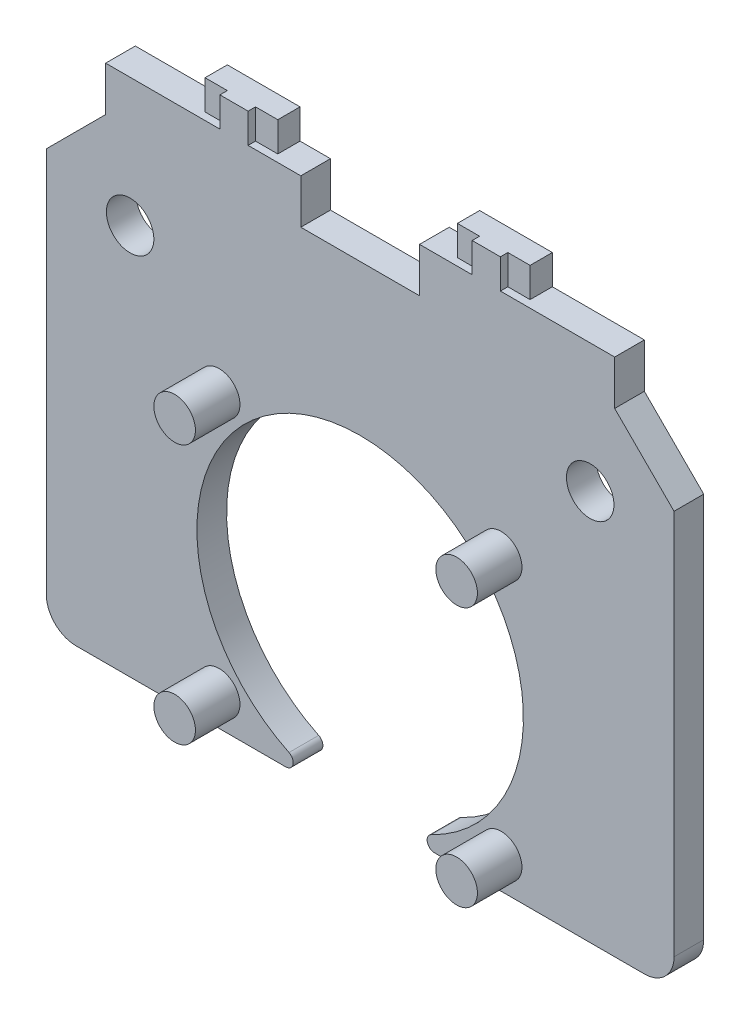
from build123d import *

# Parameters (mm, degrees)
STOCK_DRIVEBLOCK_CNC_10MM_MASTER_1_OUTLI_R = 1.6
STOCK_DRIVEBLOCK_CNC_10MM_MASTER_1_DEPTH   = 2
STOCK_DRIVEBLOCK_CNC_10MM_MASTER_1_START   = 2
STOCK_DRIVEBLOCK_CNC_10MM_MASTER_1_2_OUT_R = 1.4
STOCK_DRIVEBLOCK_CNC_10MM_MASTER_1_2_DEPTH = 3
SKETCH1_W                                  = 34.3
SKETCH1_H                                  = 2
BOSS_EXTRUDE1_DEPTH                        = 3
BOSS_EXTRUDE2_DEPTH                        = 2
SKETCH3_W                                  = 8
SKETCH3_H                                  = 3
CUT_EXTRUDE1_DEPTH                         = 10


# Read off the part's stored shape, not the designer's step: Stock-driveblock-cnc-10mm-master-1
with BuildPart() as part:
    # Stock-driveblock-cnc-10mm-master-1 outli → Stock-driveblock-cnc-10mm-master-1 (new body)
    with BuildSketch(Plane.XY):
        with BuildLine():
            Line((21.15, -8.85), (21.15, 17.15))
            Line((21.15, 17.15), (17.15, 21.15))
            Line((17.15, 21.15), (-17.15, 21.15))
            Line((-17.15, 21.15), (-21.15, 17.15))
            Line((-21.15, 17.15), (-21.15, -8.85))
            ThreePointArc((-21.15, -8.85), (-20.564213562, -10.264213562), (-19.15, -10.85))
            Line((-19.15, -10.85), (-5.012733785, -10.85))
            ThreePointArc((-5.012733785, -10.85), (-4.525394068, -10.461803399), (-4.794788838, -9.9))
            ThreePointArc((-4.794788838, -9.9), (0, 11), (4.794788838, -9.9))
            ThreePointArc((4.794788838, -9.9), (4.525394068, -10.461803399), (5.012733785, -10.85))
            Line((5.012733785, -10.85), (19.15, -10.85))
            ThreePointArc((19.15, -10.85), (20.564213562, -10.264213562), (21.15, -8.85))
        make_face()
        with Locations((-15.5, 15.5)):
            Circle(STOCK_DRIVEBLOCK_CNC_10MM_MASTER_1_OUTLI_R, mode=Mode.SUBTRACT)
        with Locations((15.5, 15.5)):
            Circle(STOCK_DRIVEBLOCK_CNC_10MM_MASTER_1_OUTLI_R, mode=Mode.SUBTRACT)
    extrude(amount=STOCK_DRIVEBLOCK_CNC_10MM_MASTER_1_DEPTH)

    # Stock-driveblock-cnc-10mm-master-1 2 out → Stock-driveblock-cnc-10mm-master-1 2 (add)
    with BuildSketch(Plane.XY.offset(STOCK_DRIVEBLOCK_CNC_10MM_MASTER_1_START)):
        with Locations((-9.5, 8.75)):
            Circle(STOCK_DRIVEBLOCK_CNC_10MM_MASTER_1_2_OUT_R)
        with Locations((9.5, 8.75)):
            Circle(STOCK_DRIVEBLOCK_CNC_10MM_MASTER_1_2_OUT_R)
        with Locations((9.5, -8.75)):
            Circle(STOCK_DRIVEBLOCK_CNC_10MM_MASTER_1_2_OUT_R)
        with Locations((-9.5, -8.75)):
            Circle(STOCK_DRIVEBLOCK_CNC_10MM_MASTER_1_2_OUT_R)
    extrude(amount=STOCK_DRIVEBLOCK_CNC_10MM_MASTER_1_2_DEPTH)

    # Sketch1 → Boss-Extrude1 (add)
    with BuildSketch(Plane(origin=(0, 21.15, 0), x_dir=(1, 0, 0), z_dir=(0, 1, 0))):
        with Locations((0, -1)):
            Rectangle(SKETCH1_W, SKETCH1_H)
    extrude(amount=BOSS_EXTRUDE1_DEPTH)

    # Sketch2 → Boss-Extrude2 (add)
    with BuildSketch(Plane(origin=(0, 24.15, 0), x_dir=(1, 0, 0), z_dir=(0, 1, 0))):
        Polygon((9.45, -1.5), (10.95, -1.5), (10.95, 0), (6.05, 0), (6.05, -1.5), (7.55, -1.5), (7.55, -2), (9.45, -2), align=None)
        Polygon((-9.45, -1.5), (-9.45, -2), (-7.55, -2), (-7.55, -1.5), (-6.05, -1.5), (-6.05, 0), (-10.95, 0), (-10.95, -1.5), align=None)
    extrude(amount=BOSS_EXTRUDE2_DEPTH)

    # Sketch3 → Cut-Extrude1 (cut)
    with BuildSketch(Plane.XY.offset(2)):
        with Locations((0, 22.65)):
            Rectangle(SKETCH3_W, SKETCH3_H)
    extrude(amount=-CUT_EXTRUDE1_DEPTH, mode=Mode.SUBTRACT)


solid = part.part
